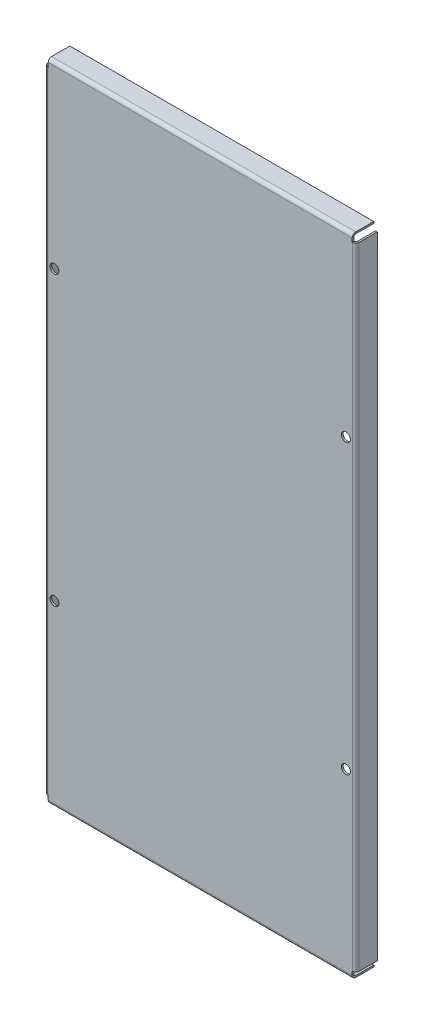
from build123d import *

# Parameters (mm, degrees)
CROQUIS1_W                   = 274.574
CROQUIS1_H                   = 569.976
BRIDA_BASE1_DEPTH            = 1.524
CROQUIS6_W                   = 3.1242
CROQUIS6_H                   = 6.35
CORTAR_EXTRUIR1_DEPTH        = 317.335586188
BRIDA_START                  = -134.1628
BRIDA_DE_ARISTA1_DEPTH       = 268.3256
BRIDA_START_2                = 6.35
BRIDA_DE_ARISTA1_2_DEPTH     = 557.276
BRIDA_DE_ARISTA1_3_DEPTH     = 268.3256
BRIDA_DE_ARISTA1_4_OUTLINE_W = 0.1524
BRIDA_DE_ARISTA1_4_OUTLINE_H = 1.524
BRIDA_DE_ARISTA1_4_DEPTH     = 0.0762
BRIDA_START_3                = 134.0866
BRIDA_DE_ARISTA1_5_OUTLINE_W = 0.1524
BRIDA_DE_ARISTA1_5_OUTLINE_H = 1.524
BRIDA_DE_ARISTA1_5_DEPTH     = 0.0762
BRIDA_DE_ARISTA1_6_DEPTH     = 557.276
CROQUIS19_R                  = 3.9624
CORTAR_EXTRUIR2_DEPTH        = 317.905006292


# Read off the part's stored shape, not the designer's step: Brida de arista1
# Sheet-metal steps are written as plain solids
with BuildPart() as part:
    # Croquis1 → Brida base1 (new body)
    with BuildSketch(Plane.XY):
        Rectangle(CROQUIS1_W, CROQUIS1_H)
    extrude(amount=-BRIDA_BASE1_DEPTH)

    # Croquis6 → Cortar-Extruir1 (cut, through all)
    with BuildSketch(Plane.XY):
        with Locations((135.7249, 281.813)):
            Rectangle(CROQUIS6_W, CROQUIS6_H)
        with Locations((-135.7249, 281.813)):
            Rectangle(CROQUIS6_W, CROQUIS6_H)
        with Locations((-135.7249, -281.813)):
            Rectangle(CROQUIS6_W, CROQUIS6_H)
        with Locations((135.7249, -281.813)):
            Rectangle(CROQUIS6_W, CROQUIS6_H)
    extrude(amount=-CORTAR_EXTRUIR1_DEPTH, mode=Mode.SUBTRACT)

    # Brida de arista1 outline → Brida de arista1 (add)
    with BuildSketch(Plane.YZ.offset(BRIDA_START)):
        with BuildLine():
            Line((284.988, -19.05), (284.988, -3.048))
            ThreePointArc((284.988, -3.048), (284.884141918, -2.259119551), (284.579645431, -1.524))
            Line((284.579645431, -1.524), (281.94, -1.524))
            ThreePointArc((281.94, -1.524), (283.017630735, -1.970369265), (283.464, -3.048))
            Line((283.464, -3.048), (283.464, -19.05))
            Line((283.464, -19.05), (284.988, -19.05))
        make_face()
        with BuildLine():
            ThreePointArc((-283.464, -3.048), (-283.017630735, -1.970369265), (-281.94, -1.524))
            Line((-281.94, -1.524), (-284.579645431, -1.524))
            ThreePointArc((-284.579645431, -1.524), (-284.884141918, -2.259119551), (-284.988, -3.048))
            Line((-284.988, -3.048), (-284.988, -19.05))
            Line((-284.988, -19.05), (-283.464, -19.05))
            Line((-283.464, -19.05), (-283.464, -3.048))
        make_face()
    extrude(amount=BRIDA_DE_ARISTA1_DEPTH)

    # Brida de arista1 2 outline → Brida de arista1 2 (add)
    with BuildSketch(Plane(origin=(0, 284.988, -1.524), x_dir=(-1, 0, 0), z_dir=(0, -1, 0)).offset(BRIDA_START_2)):
        with BuildLine():
            Line((-135.763, 1.524), (-135.763, 17.526))
            Line((-135.763, 17.526), (-137.287, 17.526))
            Line((-137.287, 17.526), (-137.287, 1.524))
            ThreePointArc((-137.287, 1.524), (-137.183141918, 0.735119551), (-136.878645431, 0))
            Line((-136.878645431, 0), (-134.239, 0))
            ThreePointArc((-134.239, 0), (-135.316630735, 0.446369265), (-135.763, 1.524))
        make_face()
        with BuildLine():
            ThreePointArc((135.763, 1.524), (135.316630735, 0.446369265), (134.239, 0))
            Line((134.239, 0), (136.878645431, 0))
            ThreePointArc((136.878645431, 0), (137.183141918, 0.735119551), (137.287, 1.524))
            Line((137.287, 1.524), (137.287, 17.526))
            Line((137.287, 17.526), (135.763, 17.526))
            Line((135.763, 17.526), (135.763, 1.524))
        make_face()
    extrude(amount=BRIDA_DE_ARISTA1_2_DEPTH)

    # Brida de arista1 3 outline → Brida de arista1 3 (cut)
    with BuildSketch(Plane.YZ.offset(BRIDA_START)):
        with BuildLine():
            ThreePointArc((281.94, 0), (283.464, -0.408354569), (284.579645431, -1.524))
            Line((284.579645431, -1.524), (284.988, -1.524))
            Line((284.988, -1.524), (284.988, 0))
            Line((284.988, 0), (281.94, 0))
        make_face()
        with BuildLine():
            ThreePointArc((-284.579645431, -1.524), (-283.464, -0.408354569), (-281.94, 0))
            Line((-281.94, 0), (-284.988, 0))
            Line((-284.988, 0), (-284.988, -1.524))
            Line((-284.988, -1.524), (-284.579645431, -1.524))
        make_face()
    extrude(amount=BRIDA_DE_ARISTA1_3_DEPTH, mode=Mode.SUBTRACT)

    # Brida de arista1 4 outline → Brida de arista1 4 (cut)
    with BuildSketch(Plane.YZ.offset(BRIDA_START)):
        with Locations((278.7142, -0.762)):
            Rectangle(BRIDA_DE_ARISTA1_4_OUTLINE_W, BRIDA_DE_ARISTA1_4_OUTLINE_H)
        with Locations((-278.7142, -0.762)):
            Rectangle(BRIDA_DE_ARISTA1_4_OUTLINE_W, BRIDA_DE_ARISTA1_4_OUTLINE_H)
    extrude(amount=BRIDA_DE_ARISTA1_4_DEPTH, mode=Mode.SUBTRACT)

    # Brida de arista1 5 outline → Brida de arista1 5 (cut)
    with BuildSketch(Plane.YZ.offset(BRIDA_START_3)):
        with Locations((278.7142, -0.762)):
            Rectangle(BRIDA_DE_ARISTA1_5_OUTLINE_W, BRIDA_DE_ARISTA1_5_OUTLINE_H)
        with Locations((-278.7142, -0.762)):
            Rectangle(BRIDA_DE_ARISTA1_5_OUTLINE_W, BRIDA_DE_ARISTA1_5_OUTLINE_H)
    extrude(amount=BRIDA_DE_ARISTA1_5_DEPTH, mode=Mode.SUBTRACT)

    # Brida de arista1 6 outline → Brida de arista1 6 (cut)
    with BuildSketch(Plane(origin=(0, 284.988, -1.524), x_dir=(-1, 0, 0), z_dir=(0, -1, 0)).offset(BRIDA_START_2)):
        with BuildLine():
            ThreePointArc((-134.239, -1.524), (-135.763, -1.115645431), (-136.878645431, 0))
            Line((-136.878645431, 0), (-137.287, 0))
            Line((-137.287, 0), (-137.287, -1.524))
            Line((-137.287, -1.524), (-134.239, -1.524))
        make_face()
        with BuildLine():
            Line((137.287, 0), (136.878645431, 0))
            ThreePointArc((136.878645431, 0), (135.763, -1.115645431), (134.239, -1.524))
            Line((134.239, -1.524), (137.287, -1.524))
            Line((137.287, -1.524), (137.287, 0))
        make_face()
    extrude(amount=BRIDA_DE_ARISTA1_6_DEPTH, mode=Mode.SUBTRACT)

    # Croquis19 → Cortar-Extruir2 (cut, through all)
    with BuildSketch(Plane.XY):
        with Locations((-128.651, 127)):
            Circle(CROQUIS19_R)
        with Locations((-128.651, -127)):
            Circle(CROQUIS19_R)
        with Locations((128.651, 127)):
            Circle(CROQUIS19_R)
        with Locations((128.651, -127)):
            Circle(CROQUIS19_R)
    extrude(amount=-CORTAR_EXTRUIR2_DEPTH, mode=Mode.SUBTRACT)


solid = part.part
